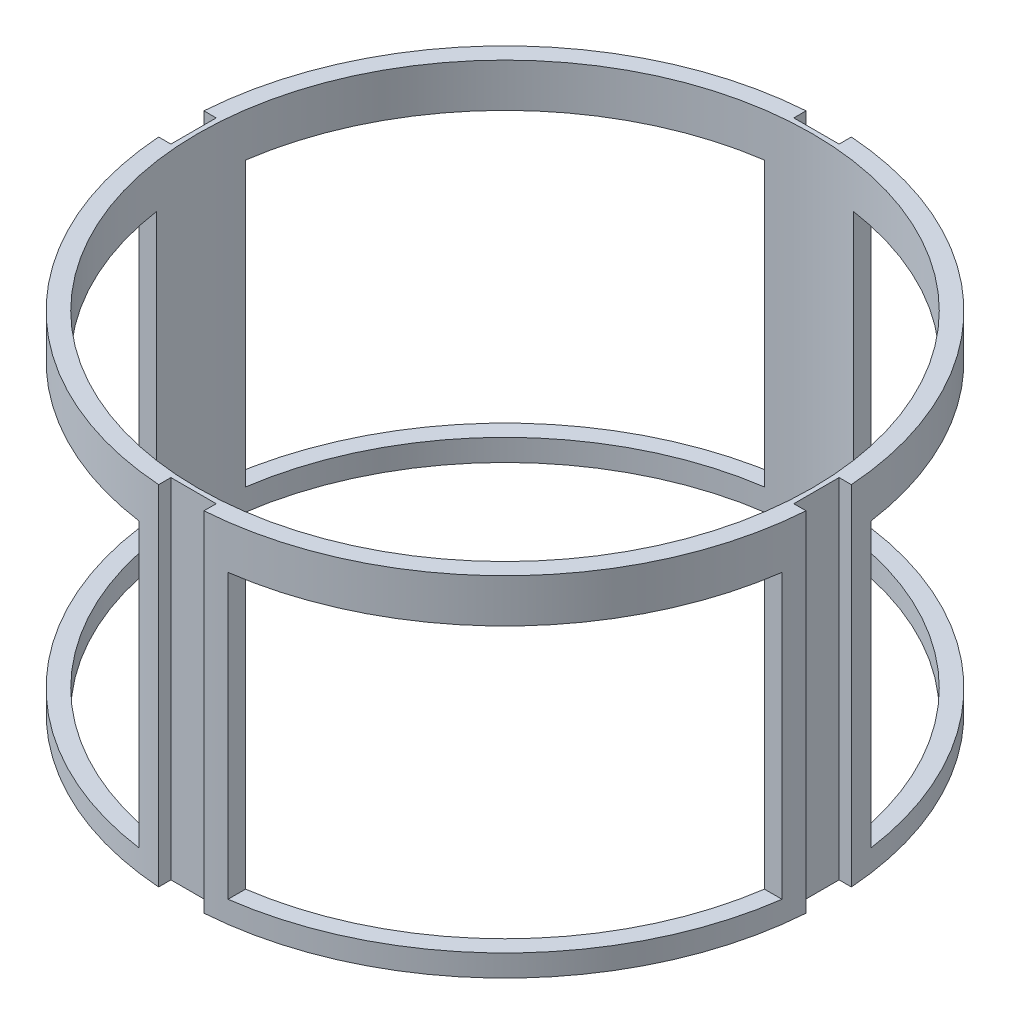
from build123d import *

# Parameters (mm, degrees)
SKETCH1_R           = 94.615
SKETCH1_R_2         = 89.535
BOSS_EXTRUDE1_DEPTH = 101.6
SKETCH5_W           = 13.208
SKETCH5_H           = 5.08
SKETCH5_W_2         = 5.08
SKETCH5_H_2         = 13.208
CUT_EXTRUDE1_DEPTH  = 101.6
CUT_EXTRUDE2_START  = -12.7
CUT_EXTRUDE2_DEPTH  = 82.55
CIRPATTERN1_COUNT   = 4


with BuildPart() as part:
    # Sketch1 → Boss-Extrude1 (new body)
    with BuildSketch(Plane(origin=(0, 0, 0), x_dir=(1, 0, 0), z_dir=(0, 1, 0))):
        Circle(SKETCH1_R)
        Circle(SKETCH1_R_2, mode=Mode.SUBTRACT)
    extrude(amount=-BOSS_EXTRUDE1_DEPTH)

    # Sketch5 → Cut-Extrude1 (cut)
    with BuildSketch(Plane(origin=(0, 0, 0), x_dir=(1, 0, 0), z_dir=(0, 1, 0))):
        with Locations((0, 93.345)):
            Rectangle(SKETCH5_W, SKETCH5_H)
        with Locations((0, -93.345)):
            Rectangle(SKETCH5_W, SKETCH5_H)
        with Locations((-93.345, 0)):
            Rectangle(SKETCH5_W_2, SKETCH5_H_2)
        with Locations((93.345, 0)):
            Rectangle(SKETCH5_W_2, SKETCH5_H_2)
    extrude(amount=-CUT_EXTRUDE1_DEPTH, mode=Mode.SUBTRACT)

    # Sketch7 → Cut-Extrude2 (cut)
    with BuildSketch(Plane(origin=(0, 0, 0), x_dir=(1, 0, 0), z_dir=(0, 1, 0)).offset(CUT_EXTRUDE2_START)):
        with BuildLine():
            Line((88.592946158, -12.954), (93.724020982, -12.954))
            ThreePointArc((93.724020982, -12.954), (66.902908102, -66.902908102), (12.954, -93.724020982))
            Line((12.954, -93.724020982), (12.954, -88.592946158))
            ThreePointArc((12.954, -88.592946158), (63.310805654, -63.310805654), (88.592946158, -12.954))
        make_face()
    cut_extrude2 = extrude(amount=-CUT_EXTRUDE2_DEPTH, mode=Mode.SUBTRACT)

    # CirPattern1: Cut-Extrude2 ×4 about axis
    cirpattern1_axis = Axis((0, 0, 0), (0, 1, 0))
    for i in range(1, CIRPATTERN1_COUNT):
        add(cut_extrude2.rotate(cirpattern1_axis, i * 360 / CIRPATTERN1_COUNT), mode=Mode.SUBTRACT)


solid = part.part
